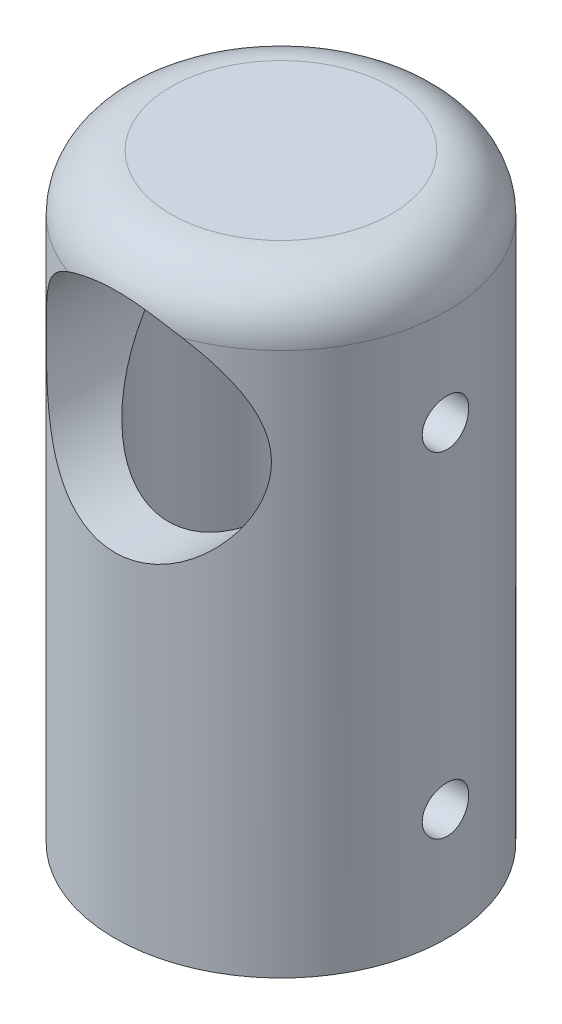
from build123d import *

# Parameters (mm, degrees)
CUT_EXTRUDE_1_DEPTH         = 35.585419616
CUT_EXTRUDE_1_DEPTH_BACK    = 35.585419616
SKETCH_2_R                  = 6.05
SKETCH_4_W                  = 1.25
SKETCH_4_H                  = 8.925
HOLE_WIZARD_M3_1_AT_2_COUNT = 2
HOLE_WIZARD_M3_1_AT_2_PITCH = 18
MIRROR_1_COPY_1_SKETCH_W    = 1.25
MIRROR_1_COPY_1_SKETCH_H    = 8.925
FILLET_1_R                  = 3


with BuildPart() as part:
    # 草图1 → 旋转1 (revolve)
    with BuildSketch(Plane.XY, mode=Mode.PRIVATE) as revolve_1_sk:
        with BuildLine():
            Line((6.05, 0), (8.925, 0))
            Line((8.925, 0), (8.925, 32.2))
            Line((8.925, 32.2), (0, 32.2))
            Line((0, 32.2), (0, 30.05))
            ThreePointArc((0, 30.05), (4.277996026, 28.277996026), (6.05, 24))
            Line((6.05, 24), (6.05, 0))
        make_face()
    revolve(revolve_1_sk.sketch.rotate(Axis((0, 32.2, 0), (0, -1, 0)), 180), axis=Axis((0, 32.2, 0), (0, -1, 0)))

    # 草图2 → 切除-拉伸1 (cut, two sides: drawn at the far end of the back side and taken through both)
    with BuildSketch(Plane.XY.offset(-CUT_EXTRUDE_1_DEPTH_BACK)):
        with Locations((0, 24)):
            Circle(SKETCH_2_R)
    extrude(amount=CUT_EXTRUDE_1_DEPTH + CUT_EXTRUDE_1_DEPTH_BACK, mode=Mode.SUBTRACT)

    # 草图4 → M3 螺纹孔1 (revolve, cut)
    with BuildSketch(Plane.ZX.offset(6)):
        with Locations((0.625, 4.4625)):
            Rectangle(SKETCH_4_W, SKETCH_4_H)
    hole_wizard_m3_1 = revolve(axis=Axis((-6.35, 6, 0), (1, 0, 0)), mode=Mode.SUBTRACT)

    # M3 螺纹孔1 at 2: M3 螺纹孔1 ×2
    with Locations(*[(0, i * HOLE_WIZARD_M3_1_AT_2_PITCH, 0) for i in range(1, HOLE_WIZARD_M3_1_AT_2_COUNT)]):
        add(hole_wizard_m3_1, mode=Mode.SUBTRACT)

    # 镜向1: M3 螺纹孔1 across plane
    add(hole_wizard_m3_1.mirror(Plane(origin=(0, 0, 0), x_dir=(0, 0, 1), z_dir=(1, 0, 0))), mode=Mode.SUBTRACT)

    # 镜向1 copy 1 sketch → 镜向1 copy 1 (revolve, cut)
    with BuildSketch(Plane.ZX.offset(24)):
        with Locations((0.625, -4.4625)):
            Rectangle(MIRROR_1_COPY_1_SKETCH_W, MIRROR_1_COPY_1_SKETCH_H)
    revolve(axis=Axis((6.35, 24, 0), (1, 0, 0)), mode=Mode.SUBTRACT)

    # 圆角1
    # the kernel refuses this fillet: 3 mm, written as the material it takes off along each edge
    with BuildSketch(Plane(origin=(0, 32.2, 0), x_dir=(-1, 0, 0), z_dir=(0, 0, 1))) as fillet_1_piece_1:
        with BuildLine():
            CenterArc((8.925 - FILLET_1_R, FILLET_1_R), FILLET_1_R, 270, 90)
            Line((8.925 - FILLET_1_R, 0), (8.925, 0))
            Line((8.925, 0), (8.925, FILLET_1_R))
        make_face()
    revolve(axis=Axis((0, 32.2, 0), (0, -1, 0)), mode=Mode.SUBTRACT)


solid = part.part
